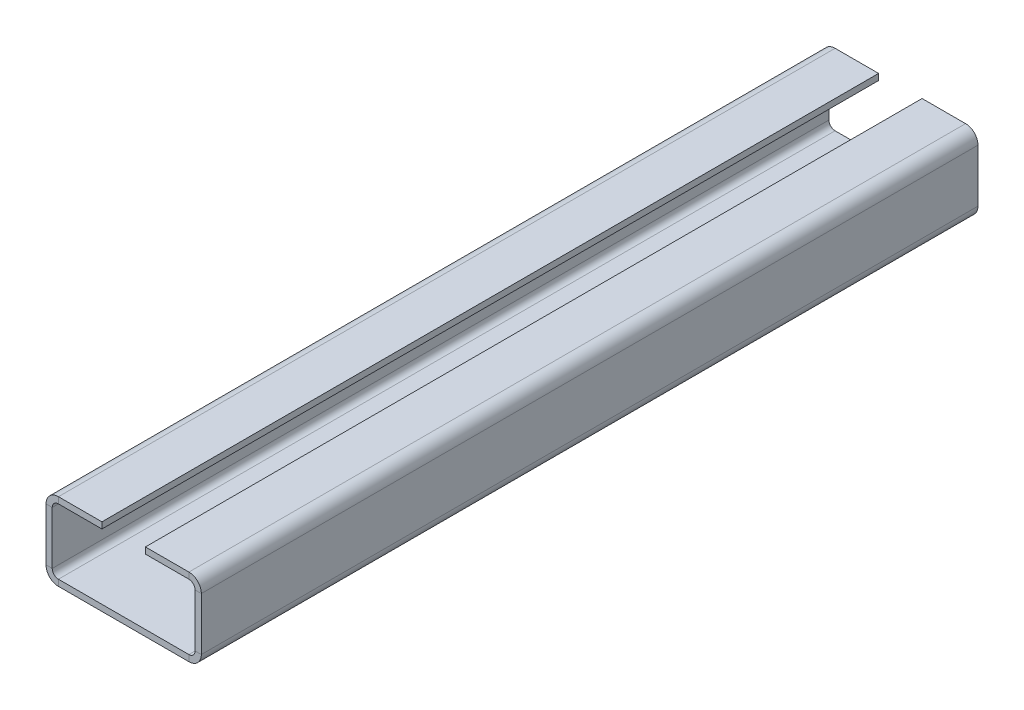
from build123d import *

# Parameters (mm, degrees)
BASE_FLANGE1_DEPTH = 250


# Sheet-metal steps are written as plain solids
with BuildPart() as part:
    # Sketch1 → Base-Flange1 (new body)
    with BuildSketch(Plane.XY):
        with BuildLine():
            Line((18, 25), (4, 25))
            ThreePointArc((4, 25), (1.171572875, 23.828427125), (0, 21))
            Line((0, 21), (0, 4))
            ThreePointArc((0, 4), (1.171572875, 1.171572875), (4, 0))
            Line((4, 0), (46, 0))
            ThreePointArc((46, 0), (48.828427125, 1.171572875), (50, 4))
            Line((50, 4), (50, 21))
            ThreePointArc((50, 21), (48.828427125, 23.828427125), (46, 25))
            Line((46, 25), (32, 25))
            Line((32, 25), (32, 23))
            Line((32, 23), (46, 23))
            ThreePointArc((46, 23), (47.414213562, 22.414213562), (48, 21))
            Line((48, 21), (48, 4))
            ThreePointArc((48, 4), (47.414213562, 2.585786438), (46, 2))
            Line((46, 2), (4, 2))
            ThreePointArc((4, 2), (2.585786438, 2.585786438), (2, 4))
            Line((2, 4), (2, 21))
            ThreePointArc((2, 21), (2.585786438, 22.414213562), (4, 23))
            Line((4, 23), (18, 23))
            Line((18, 23), (18, 25))
        make_face()
    extrude(amount=BASE_FLANGE1_DEPTH)


solid = part.part
